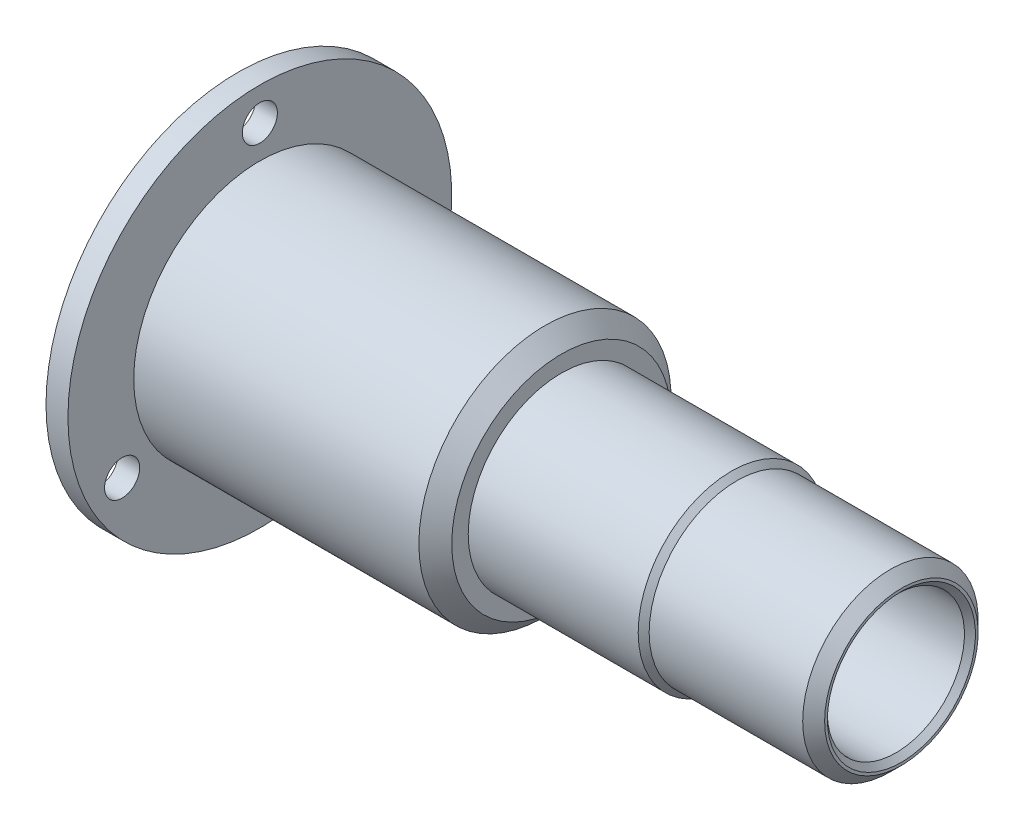
from build123d import *

# Parameters (mm, degrees)
CHAMFER_1_SIZE      = 1.5
CHAMFER_2_SIZE      = 1
CHAMFER_3_SIZE      = 1
CHAMFER_4_SIZE      = 0.5
SKETCH_2_R          = 1.6
CUT_EXTRUDE_1_DEPTH = 10


with BuildPart() as part:
    # Эскиз1 → Повернуть1 (revolve)
    with BuildSketch(Plane.XY, mode=Mode.PRIVATE) as revolve_1_sk:
        Polygon((26.5, 6.25), (26.5, 9), (0, 9), (0, 17.5), (2, 17.5), (2, 11.5), (29.5, 11.5), (29.5, 8.5), (45.5, 8.5), (45.5, 8), (60.5, 8), (60.5, 6.25), align=None)
    revolve(revolve_1_sk.sketch.rotate(Axis((0, 0, 0), (1, 0, 0)), 90), axis=Axis((0, 0, 0), (1, 0, 0)))

    # Фаска1
    chamfer_1_edges = [part.edges().sort_by_distance(p)[0] for p in [
        (29.5, 0, -11.5),
    ]]
    chamfer(chamfer_1_edges, length=CHAMFER_1_SIZE)

    # Фаска2
    chamfer_2_edges = [part.edges().sort_by_distance(p)[0] for p in [
        (0, 0, -9),
    ]]
    chamfer(chamfer_2_edges, length=CHAMFER_2_SIZE)

    # Фаска3
    chamfer_3_edges = [part.edges().sort_by_distance(p)[0] for p in [
        (60.5, 0, -8),
    ]]
    chamfer(chamfer_3_edges, length=CHAMFER_3_SIZE)

    # Фаска4
    chamfer_4_edges = [part.edges().sort_by_distance(p)[0] for p in [
        (45.5, 0, -8.5),
        (60.5, 0, -6.25),
    ]]
    chamfer(chamfer_4_edges, length=CHAMFER_4_SIZE - 0.0001)  # a hair under: the kernel refuses the full size

    # Эскиз2 → Вырез-Вытянуть1 (cut)
    with BuildSketch(Plane.ZY):
        with Locations((0, 14.5)):
            Circle(SKETCH_2_R)
        with Locations((12.557368355, -7.25)):
            Circle(SKETCH_2_R)
        with Locations((-12.557368355, -7.25)):
            Circle(SKETCH_2_R)
    extrude(amount=-CUT_EXTRUDE_1_DEPTH, mode=Mode.SUBTRACT)


solid = part.part
